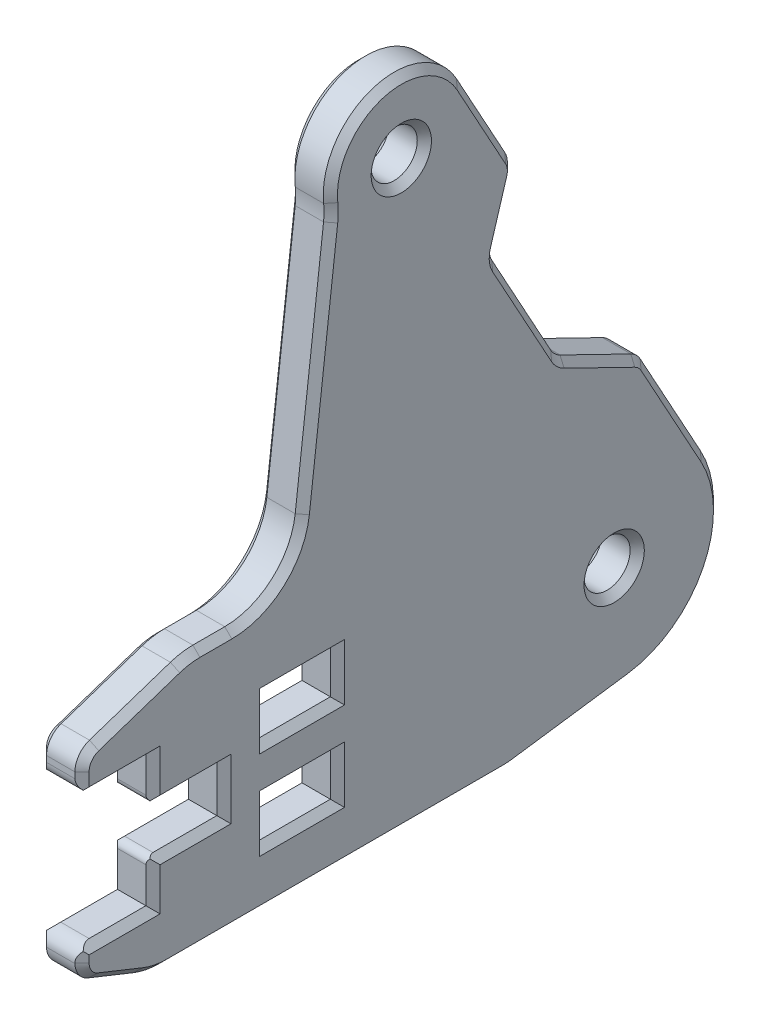
from build123d import *

# Parameters (mm, degrees)
SKETCH_1_R      = 1.625
SKETCH_1_W      = 5
SKETCH_1_H      = 3
EXTRUDE_1_DEPTH = 3
CHAMFER_1_SIZE  = 0.5
FILLET_1_R      = 1
FILLET_2_R      = 0.5
EXTRUDE_2_DEPTH = 3


with BuildPart() as part:
    # 草图1 → 凸台-拉伸1 (new body)
    with BuildSketch(Plane(origin=(1.5, 0, 0), x_dir=(0, 0, -1), z_dir=(1, 0, 0))):
        with BuildLine():
            Line((-7.154542269, -8.576560818), (1.041442411, -7.427341227))
            ThreePointArc((1.041442411, -7.427341227), (6.705040976, -3.360420437), (6.573553871, 3.610871017))
            Line((6.573553871, 3.610871017), (2.332034096, 11.332514521))
            ThreePointArc((2.332034096, 11.332514521), (2.051803428, 11.696549741), (1.674538126, 11.958698097))
            Line((1.674538126, 11.958698097), (-3.312005463, 14.389232718))
            ThreePointArc((-3.312005463, 14.389232718), (-3.689270765, 14.651381075), (-3.969501433, 15.015416295))
            Line((-3.969501433, 15.015416295), (-8.120214479, 22.571747074))
            ThreePointArc((-8.120214479, 22.571747074), (-8.297319992, 23.137447109), (-8.241448295, 23.727583743))
            Line((-8.241448295, 23.727583743), (-7.088083158, 27.546610192))
            ThreePointArc((-7.088083158, 27.546610192), (-7.032211461, 28.136746826), (-7.209316974, 28.702446861))
            Line((-7.209316974, 28.702446861), (-10.617630753, 34.907247345))
            ThreePointArc((-10.617630753, 34.907247345), (-16.500374515, 37.269578211), (-19.97127937, 31.964853827))
            ThreePointArc((-19.97127937, 31.964853827), (-19.942635933, 31.401924032), (-19.977533596, 30.839347323))
            Line((-19.977533596, 30.839347323), (-21.975677109, 14.034639668))
            ThreePointArc((-21.975677109, 14.034639668), (-23.620446364, 10.886564387), (-26.940702253, 9.625))
            Line((-26.940702253, 9.625), (-29.188611699, 9.625))
            ThreePointArc((-29.188611699, 9.625), (-29.989522914, 9.560437288), (-30.769750529, 9.36841649))
            Line((-30.769750529, 9.36841649), (-36.474341649, 7.466886117))
            ThreePointArc((-36.474341649, 7.466886117), (-37.216863278, 6.920926597), (-37.5, 6.04386117))
            Line((-37.5, 6.04386117), (-37.5, 4.625))
            Line((-37.5, 4.625), (-32.5, 4.625))
            Line((-32.5, 4.625), (-32.5, 1.625))
            Line((-32.5, 1.625), (-27.5, 1.625))
            Line((-27.5, 1.625), (-27.5, -1.625))
            Line((-27.5, -1.625), (-32.5, -1.625))
            Line((-32.5, -1.625), (-32.5, -4.625))
            Line((-32.5, -4.625), (-37.5, -4.625))
            Line((-37.5, -4.625), (-37.5, -5.609450558))
            ThreePointArc((-37.5, -5.609450558), (-37.242100846, -6.450393772), (-36.557086015, -7.002165594))
            Line((-36.557086015, -7.002165594), (-33.394041364, -8.267383454))
            ThreePointArc((-33.394041364, -8.267383454), (-32.482625588, -8.534781934), (-31.537087982, -8.625))
            Line((-31.537087982, -8.625), (-7.848837209, -8.625))
            ThreePointArc((-7.848837209, -8.625), (-7.500845895, -8.612875504), (-7.154542269, -8.576560818))
        make_face()
        with Locations(Location((-15, 32.5, 0), (0, 0, 180))):
            Circle(SKETCH_1_R, mode=Mode.SUBTRACT)
        with Locations(Location((0, 0, 0), (0, 0, 180))):
            Circle(SKETCH_1_R, mode=Mode.SUBTRACT)
        with Locations((-22, 3.125)):
            Rectangle(SKETCH_1_W, SKETCH_1_H, mode=Mode.SUBTRACT)
        with Locations((-22, -3.125)):
            Rectangle(SKETCH_1_W, SKETCH_1_H, mode=Mode.SUBTRACT)
        with BuildLine():
            Line((-9.961966793, 5.476712688), (-17.295484898, 21.366001917))
            ThreePointArc((-17.295484898, 21.366001917), (-16.439907786, 23.68828265), (-14.117627052, 22.832705538))
            Line((-14.117627052, 22.832705538), (-6.784108947, 6.943416309))
            ThreePointArc((-6.784108947, 6.943416309), (-7.639686059, 4.621135575), (-9.961966793, 5.476712688))
        make_face(mode=Mode.SUBTRACT)
    extrude(amount=-EXTRUDE_1_DEPTH)

    # 倒角1
    chamfer_1_edges = [part.edges().sort_by_distance(p)[0] for p in [
        (-1.5, 0, 27.5),
        (-1.5, -3.125, 24.5),
        (-1.5, -1.625, 22),
        (-1.5, -3.125, 19.5),
        (-1.5, -4.625, 22),
        (1.5, -3.125, 24.5),
        (1.5, -4.625, 22),
        (1.5, -3.125, 19.5),
        (-1.5, -1.625, 30),
        (1.5, -1.625, 22),
        (-1.5, -3.125, 32.5),
        (-1.5, -4.625, 35),
        (-1.5, 4.621135575, 7.639686059),
        (-1.5, 13.421357302, 13.628725845),
        (-1.5, 23.68828265, 16.439907786),
        (-1.5, 14.888060923, 10.450868),
        (-1.5, -5.117225279, 37.5),
        (1.5, 4.621135575, 7.639686059),
        (1.5, 14.888060923, 10.450868),
        (1.5, 23.68828265, 16.439907786),
        (1.5, 13.421357302, 13.628725845),
        (-1.5, -6.450393772, 37.242100846),
        (-1.5, -7.634774524, 34.975563689),
        (-1.5, -8.534781934, 32.482625588),
        (-1.5, -3.360420437, -6.705040976),
        (-1.5, -8.625, 19.692962596),
        (-1.5, 7.471692769, -4.452793984),
        (-1.5, 11.696549741, -2.051803428),
        (-1.5, 13.173965408, 0.818733668),
        (-1.5, 14.651381075, 3.689270765),
        (1.5, -8.625, 19.692962596),
        (1.5, -8.534781934, 32.482625588),
        (1.5, -7.634774524, 34.975563689),
        (1.5, -6.450393772, 37.242100846),
        (1.5, -5.117225279, 37.5),
        (-1.5, 18.793581684, 6.044857956),
        (1.5, -4.625, 35),
        (1.5, -3.125, 32.5),
        (1.5, -1.625, 30),
        (1.5, 0, 27.5),
        (1.5, 1.625, 30),
        (1.5, 3.125, 32.5),
        (1.5, 4.625, 35),
        (1.5, 5.334430585, 37.5),
        (1.5, 6.920926597, 37.216863278),
        (1.5, 8.417651304, 33.622046089),
        (-1.5, 23.137447109, 8.297319992),
        (1.5, 9.560437288, 29.989522914),
        (1.5, 9.625, 28.064656976),
        (1.5, 10.886564387, 23.620446364),
        (1.5, 22.436993496, 20.976605353),
        (1.5, 31.401924032, 19.942635933),
        (1.5, 37.269578211, 16.500374515),
        (1.5, 31.804847103, 8.913473863),
        (1.5, 28.136746826, 7.032211461),
        (1.5, 25.637096968, 7.664765726),
        (1.5, 23.137447109, 8.297319992),
        (-1.5, 25.637096968, 7.664765726),
        (1.5, 18.793581684, 6.044857956),
        (1.5, 14.651381075, 3.689270765),
        (1.5, 13.173965408, 0.818733668),
        (1.5, 11.696549741, -2.051803428),
        (1.5, 7.471692769, -4.452793984),
        (1.5, -3.360420437, -6.705040976),
        (1.5, -8.001951023, 3.056549929),
        (1.5, -8.612875504, 7.500845895),
        (-1.5, 28.136746826, 7.032211461),
        (-1.5, 31.804847103, 8.913473863),
        (-1.5, -8.612875504, 7.500845895),
        (-1.5, 37.269578211, 16.500374515),
        (-1.5, 31.401924032, 19.942635933),
        (-1.5, 22.436993496, 20.976605353),
        (-1.5, 10.886564387, 23.620446364),
        (-1.5, 9.625, 28.064656976),
        (-1.5, 9.560437288, 29.989522914),
        (-1.5, 8.417651304, 33.622046089),
        (-1.5, 32.5, 13.375),
        (1.5, 32.5, 13.375),
        (-1.5, 6.920926597, 37.216863278),
        (-1.5, 0, -1.625),
        (1.5, 0, -1.625),
        (-1.5, 5.334430585, 37.5),
        (-1.5, 4.625, 35),
        (-1.5, 3.125, 19.5),
        (-1.5, -8.001951023, 3.056549929),
        (-1.5, 1.625, 22),
        (-1.5, 3.125, 24.5),
        (-1.5, 4.625, 22),
        (1.5, 3.125, 19.5),
        (1.5, 4.625, 22),
        (1.5, 3.125, 24.5),
        (1.5, 1.625, 22),
        (-1.5, 3.125, 32.5),
        (-1.5, 1.625, 30),
    ]]
    chamfer(chamfer_1_edges, length=CHAMFER_1_SIZE)

    # 圆角1
    # the kernel refuses this fillet: 1 mm, written as the material it takes off along each edge
    with BuildSketch(Plane(origin=(3.577747849, -4.625, 37.5), x_dir=(0, -0.9999997524396673, -0.000703648068189184), z_dir=(-1, 0, 0))) as fillet_1_piece_1:
        with BuildLine():
            CenterArc((1.000703571, -0.999537948), FILLET_1_R, 88.258193912, 91.782122156)
            Line((0.000703818, -1.000241596), (-0.099296157, -1.000311961))
            Line((-0.099296157, -1.000311961), (-0.099999975, -7.0365e-05))
            Line((-0.099999975, -7.0365e-05), (-7.0365e-05, 0.099999975))
            ThreePointArc((-7.0365e-05, 0.099999975), (0.984379949, 0.100692682), (1.034138696, 0.099953795))
            Line((1.034138696, 0.099953795), (1.03109914, 0))
        make_face()
    extrude(amount=7.155495698, mode=Mode.SUBTRACT)
    with BuildSketch(Plane(origin=(3.5, 4.625, 37.5), x_dir=(0, 0, -1), z_dir=(-1, 0, 0))) as fillet_1_piece_2:
        with BuildLine():
            CenterArc((FILLET_1_R, -FILLET_1_R), FILLET_1_R, 90, 90)
            Line((0, -FILLET_1_R), (0, 0))
            Line((0, 0), (FILLET_1_R, 0))
        make_face()
    extrude(amount=7, mode=Mode.SUBTRACT)

    # 圆角2
    fillet_2_edges = [part.edges().sort_by_distance(p)[0] for p in [
        (0, 1.625, 32.5),
        (0, -1.625, 32.5),
    ]]
    fillet(fillet_2_edges, radius=FILLET_2_R)

    # Sketch 3D_1 → 凸台-拉伸2 (add)
    with BuildSketch(Plane(origin=(1.5, 22.89191641, 19.156270075), x_dir=(0, -0.8525521578237779, -0.5226421511799639), z_dir=(1, 0, 0))):
        Polygon((0, 0), (16.191873752, -5.770917197), (27.468575768, 0), (19.557121084, 8.11942404), (6.27778787, 5.658813531), (-1.099641064, 7.65553458), (-1.226258679, 2.829349925), align=None)
    extrude(amount=-EXTRUDE_2_DEPTH)


solid = part.part
